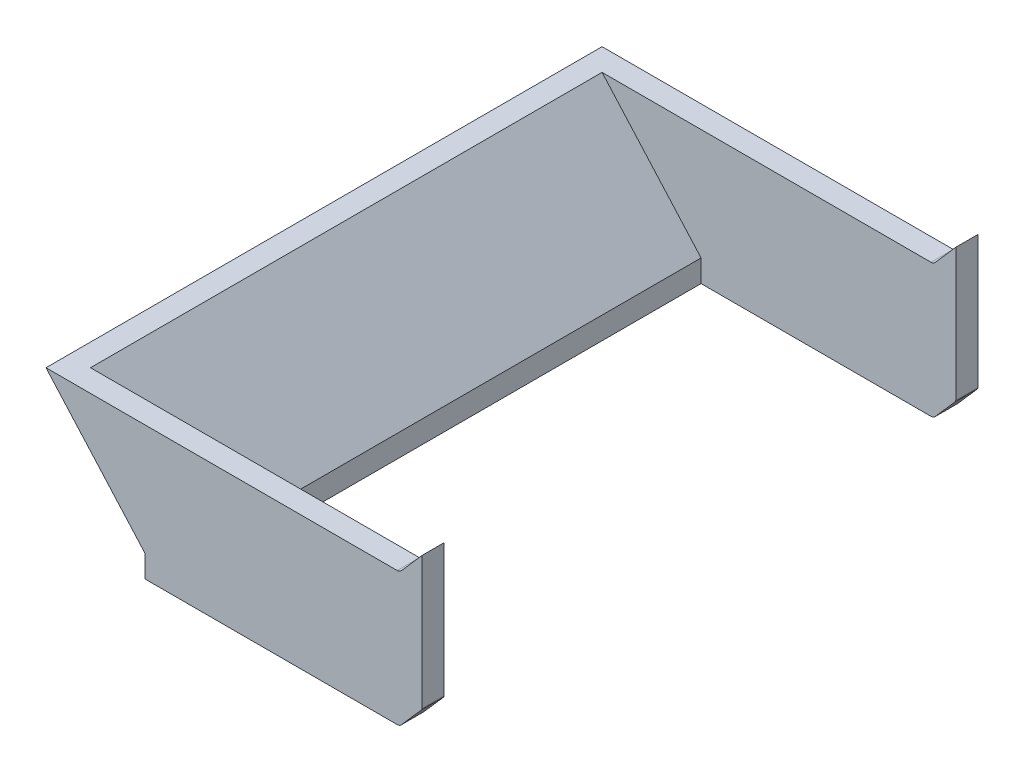
from build123d import *

# Parameters (mm, degrees)
BOSS_EXTRUDE1_DEPTH = 50
CUT_EXTRUDE1_DEPTH  = 13
FILLET1_R           = 0.2
CUT_EXTRUDE2_DEPTH  = 22.9
BOSS_EXTRUDE2_DEPTH = 2
BOSS_EXTRUDE4_START = -50
BOSS_EXTRUDE4_DEPTH = 2


with BuildPart() as part:
    # Sketch1 → Boss-Extrude1 (new body)
    with BuildSketch(Plane.XY):
        with BuildLine():
            Line((-0.226533162, 0), (-22.9, 0))
            Line((-22.9, 0), (-22.9, 2))
            Line((-22.9, 2), (-1.79756025, 2))
            ThreePointArc((-1.79756025, 2), (-1.552823997, 2.063990635), (-1.370731057, 2.239583333))
            ThreePointArc((-1.370731057, 2.239583333), (-0.802551257, 2.977276557), (-0.088888889, 3.575361503))
            ThreePointArc((-0.088888889, 3.575361503), (-0.023616579, 3.647376483), (0, 3.741657387))
            Line((0, 3.741657387), (0, 4))
            Line((0, 4), (2, 4))
            Line((2, 4), (2, 2.355630783))
            ThreePointArc((2, 2.355630783), (1.987179561, 2.285176459), (1.950361882, 2.223754688))
            Line((1.950361882, 2.223754688), (0.149371544, 0.170309763))
            ThreePointArc((0.149371544, 0.170309763), (-0.020190145, 0.044563331), (-0.226533162, 0))
        make_face()
    extrude(amount=-BOSS_EXTRUDE1_DEPTH)

    # Sketch3 → Loft1 section 0
    with BuildSketch(Plane(origin=(0, 2, 0), x_dir=(1, 0, 0), z_dir=(0, 1, 0))):
        with BuildLine():
            Line((2, 50), (-22.9, 50))
            Line((-22.9, 50), (-22.9, 0))
            Line((-22.9, 0), (2, 0))
            Line((2, 0), (2, 2))
            Line((2, 2), (-20.9, 2))
            Line((-20.9, 2), (-20.9, 48))
            Line((-20.9, 48), (2, 48))
            Line((2, 48), (2, 50))
        make_face()
    # Sketch4 → Loft1 section 1
    with BuildSketch(Plane(origin=(0, 12, 0), x_dir=(-1, 0, 0), z_dir=(0, 1, 0))):
        with BuildLine():
            Line((-2, -50), (31.8, -50))
            Line((31.8, -50), (31.8, 0))
            Line((31.8, 0), (-2, 0))
            Line((-2, 0), (-2, -2))
            Line((-2, -2), (29.8, -2))
            Line((29.8, -2), (29.8, -48))
            Line((29.8, -48), (-2, -48))
            Line((-2, -48), (-2, -50))
        make_face()
    loft()

    # Sketch5 → Cut-Extrude1 (cut)
    with BuildSketch(Plane(origin=(0, 0, 0), x_dir=(0, 0, -1), z_dir=(0.7518094115561124, -0.6593804733957871, 0))):
        Polygon((50, 0.226533162), (0, 0.226533162), (-3.433361375, 0.226533162), (-3.433361375, 4.468376884), (51.426542164, 4.468376884), (51.426542164, 0.226533162), align=None)
    extrude(amount=CUT_EXTRUDE1_DEPTH, mode=Mode.SUBTRACT)

    # Fillet1
    # the kernel refuses this fillet: 0.2 mm, written as the material it takes off along each edge
    with BuildSketch(Plane(origin=(2, 2.28035085, -47.811800168), x_dir=(0, 1, 0), z_dir=(0, 0, -1)), Plane(origin=(2, 2.28035085, 0.188199832), x_dir=(0, 1, 0), z_dir=(0, 0, -1))) as fillet1_piece_1:
        with BuildLine():
            CenterArc((FILLET1_R * 0.376399663711, -FILLET1_R), FILLET1_R, 90, 41.252641273)
            Line((-FILLET1_R * 0.282980809685, -FILLET1_R * 0.248190588444), (0, 0))
            Line((0, 0), (FILLET1_R * 0.376399663711, 0))
        make_face()
    extrude(amount=2.376399664, mode=Mode.SUBTRACT)

    # Sketch6 → Cut-Extrude2 (cut)
    with BuildSketch(Plane(origin=(2, 0, 0), x_dir=(0, 0, -1), z_dir=(1, 0, 0))):
        Polygon((2, 4), (2, 12), (48, 12), (48, 4), (48, -3.389982461), (2, -3.389982461), align=None)
    extrude(amount=-CUT_EXTRUDE2_DEPTH, mode=Mode.SUBTRACT)

    # Sketch7 → Boss-Extrude2 (add)
    with BuildSketch(Plane.XY):
        with BuildLine():
            Line((2, 14.28035085), (2, 12))
            Line((2, 12), (-0.226533162, 12))
            ThreePointArc((-0.226533162, 12), (-0.020190145, 12.044563331), (0.149371544, 12.170309763))
            Line((0.149371544, 12.170309763), (2, 14.28035085))
        make_face()
    extrude(amount=-BOSS_EXTRUDE2_DEPTH)

    # Sketch7<2> → Boss-Extrude4 (add)
    with BuildSketch(Plane.XY.offset(BOSS_EXTRUDE4_START)):
        with BuildLine():
            Line((2, 14.28035085), (2, 12))
            Line((2, 12), (-0.226533162, 12))
            ThreePointArc((-0.226533162, 12), (-0.020190145, 12.044563331), (0.149371544, 12.170309763))
            Line((0.149371544, 12.170309763), (2, 14.28035085))
        make_face()
    extrude(amount=BOSS_EXTRUDE4_DEPTH)


solid = part.part
